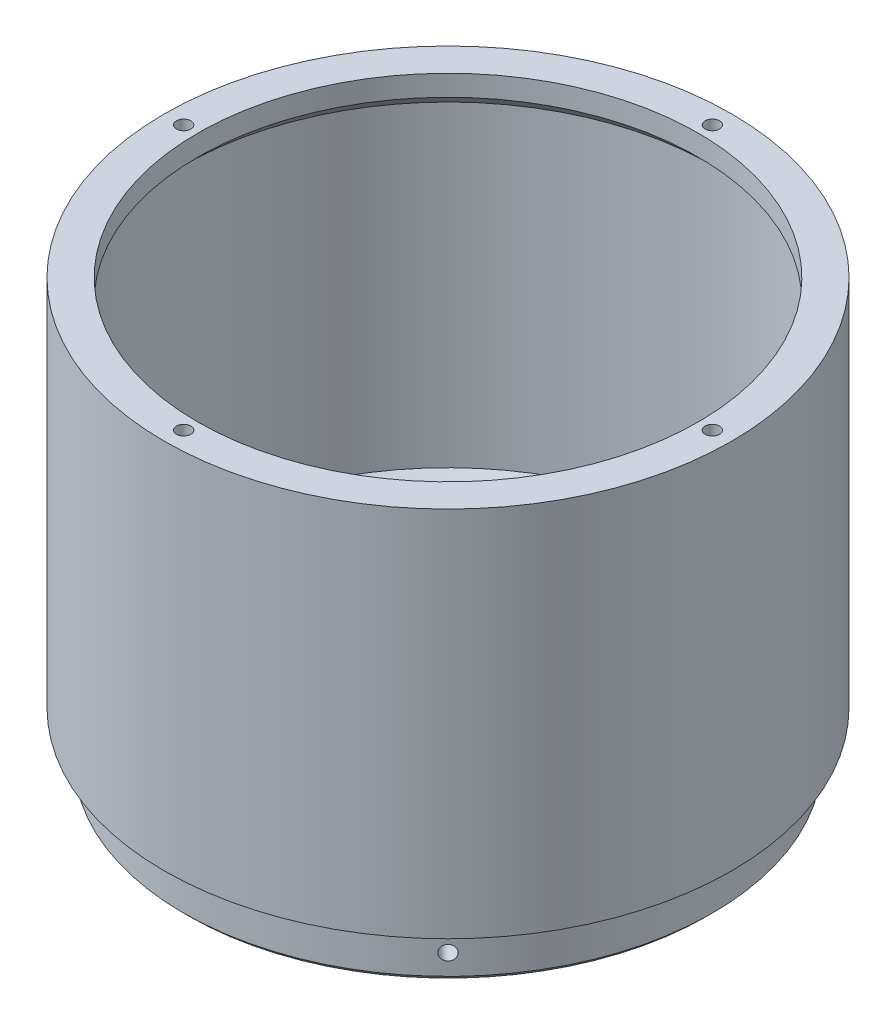
from build123d import *

# Parameters (mm, degrees)
SCHIZZO1_R                         = 110.5
SCHIZZO1_R_2                       = 103
ESTRUSIONE_ESTRUSIONE1_DEPTH       = 136.9
ESTRUSIONE_ESTRUSIONE2_DEPTH       = 10
ESTRUSIONE_ESTRUSIONE2_DEPTH_BACK  = 20
SCHIZZO1_3_R                       = 103
SCHIZZO1_3_R_2                     = 95
SMUSSO1_SIZE                       = 10
SMUSSO2_SIZE                       = 2
SCHIZZO2_R                         = 110.5
SCHIZZO2_R_2                       = 97.5
ESTRUSIONE_ESTRUSIONE3_DEPTH       = 8.1
SMUSSO3_SIZE                       = 5.5
FORO_PER_VITE_M4_1_D               = 5.6
FORO_PER_VITE_M4_1_DEPTH           = 8.1
FORO_PER_VITE_M4_1_TIP             = 1.682409733
FORO_PER_VITE_M4_2_D               = 5.6
FORO_PER_VITE_M4_2_DEPTH           = 8.1
FORO_PER_VITE_M4_2_TIP             = 1.682409733
FORO_PER_VITE_M4_2_ON_FACE_2_D     = 5.6
FORO_PER_VITE_M4_2_ON_FACE_2_DEPTH = 8.1
FORO_PER_VITE_M4_2_ON_FACE_2_TIP   = 1.682409733
FORO_PER_VITE_M4_2_ON_FACE_3_D     = 5.6
FORO_PER_VITE_M4_2_ON_FACE_3_DEPTH = 8.1
FORO_PER_VITE_M4_2_ON_FACE_3_TIP   = 1.682409733
FORO_PER_VITE_M4_2_ON_FACE_4_D     = 5.6
FORO_PER_VITE_M4_2_ON_FACE_4_DEPTH = 8.1
FORO_PER_VITE_M4_2_ON_FACE_4_TIP   = 1.682409733
ESTRUSIONE_ESTRUSIONE4_DEPTH       = 46
SMUSSO4_SIZE                       = 2


# Read off the part's stored shape, not the designer's step: Foro per Vite M4-3
# Some blends are built 0.0001 mm under size
with BuildPart() as part:
    # Schizzo1 → Estrusione-Estrusione1 (new body)
    with BuildSketch(Plane(origin=(0, 0, 0), x_dir=(1, 0, 0), z_dir=(0, 1, 0))):
        with Locations(Location((0, 0, 0), (0, 0, 270))):
            Circle(SCHIZZO1_R)
        with Locations(Location((0, 0, 0), (0, 0, 270))):
            Circle(SCHIZZO1_R_2, mode=Mode.SUBTRACT)
    extrude(amount=ESTRUSIONE_ESTRUSIONE1_DEPTH)

    # Schizzo1<3> → Estrusione-Estrusione2 (add, two sides: drawn at the far end of the back side and taken through both)
    with BuildSketch(Plane(origin=(0, 0, 0), x_dir=(1, 0, 0), z_dir=(0, 1, 0)).offset(-ESTRUSIONE_ESTRUSIONE2_DEPTH_BACK)):
        with Locations(Location((0, 0, 0), (0, 0, 270))):
            Circle(SCHIZZO1_3_R)
        with Locations(Location((0, 0, 0), (0, 0, 270))):
            Circle(SCHIZZO1_3_R_2, mode=Mode.SUBTRACT)
    extrude(amount=ESTRUSIONE_ESTRUSIONE2_DEPTH + ESTRUSIONE_ESTRUSIONE2_DEPTH_BACK)

    # Smusso1
    # the kernel refuses this chamfer: 10 mm, written as the material it takes off along each edge
    with BuildSketch(Plane(origin=(0, 10, 0), x_dir=(0, 0, 1), z_dir=(-1, 0, 0))) as smusso1_piece_1_section:
        Polygon((95 + SMUSSO1_SIZE, 0), (95, -SMUSSO1_SIZE), (95, 0), align=None)
    smusso1_piece_1 = revolve(axis=Axis((0, 10, 0), (0, 1, 0)), mode=Mode.PRIVATE)
    smusso1_piece_1 = smusso1_piece_1 & Plane(origin=(0, 4.08333284, 0), x_dir=(0, 0, 1), z_dir=(0, -1, 0)) * Cylinder(103, 420, mode=Mode.PRIVATE)
    add(smusso1_piece_1, mode=Mode.SUBTRACT)

    # Smusso2
    smusso2_edges = [part.edges().sort_by_distance(p)[0] for p in [
        (0, -20, -95),
        (0, -20, -103),
    ]]
    chamfer(smusso2_edges, length=SMUSSO2_SIZE)

    # Schizzo2 → Estrusione-Estrusione3 (add)
    with BuildSketch(Plane(origin=(0, 136.9, 0), x_dir=(1, 0, 0), z_dir=(0, 1, 0))):
        with Locations(Location((0, 0, 0), (0, 0, 270))):
            Circle(SCHIZZO2_R)
        with Locations(Location((0, 0, 0), (0, 0, 270))):
            Circle(SCHIZZO2_R_2, mode=Mode.SUBTRACT)
    extrude(amount=ESTRUSIONE_ESTRUSIONE3_DEPTH)

    # Smusso3
    smusso3_edges = [part.edges().sort_by_distance(p)[0] for p in [
        (0, 136.9, -103),
    ]]
    chamfer(smusso3_edges, length=SMUSSO3_SIZE - 0.0001)  # a hair under: the kernel refuses the full size

    # Foro per Vite M4-1
    with Locations(Plane(origin=(0, 145, 0), x_dir=(1, 0, 0), z_dir=(0, 1, 0))):
        with Locations((0, 103), (0, -103), (103, 0), (-103, 0)):
            Hole(FORO_PER_VITE_M4_1_D / 2, depth=FORO_PER_VITE_M4_1_DEPTH)
            with Locations((0, 0, -(FORO_PER_VITE_M4_1_DEPTH + FORO_PER_VITE_M4_1_TIP / 2))):  # 118° drill point
                Cone(0, FORO_PER_VITE_M4_1_D / 2, FORO_PER_VITE_M4_1_TIP, mode=Mode.SUBTRACT)

    # Foro per Vite M4-2
    with Locations(Plane(origin=(72.831998462, -10, -72.831998462), x_dir=(0.707106781187, 0, 0.707106781187), z_dir=(0.707106781187, 0, -0.707106781187))):
        with Locations((0, 0)):
            Hole(FORO_PER_VITE_M4_2_D / 2, depth=FORO_PER_VITE_M4_2_DEPTH)
            with Locations((0, 0, -(FORO_PER_VITE_M4_2_DEPTH + FORO_PER_VITE_M4_2_TIP / 2))):  # 118° drill point
                Cone(0, FORO_PER_VITE_M4_2_D / 2, FORO_PER_VITE_M4_2_TIP, mode=Mode.SUBTRACT)

    # Foro per Vite M4-2 on face 2
    with Locations(Plane(origin=(-72.831998462, -10, -72.831998462), x_dir=(-0.707106781187, 0, 0.707106781187), z_dir=(-0.707106781187, 0, -0.707106781187))):
        with Locations((0, 0)):
            Hole(FORO_PER_VITE_M4_2_ON_FACE_2_D / 2, depth=FORO_PER_VITE_M4_2_ON_FACE_2_DEPTH)
            with Locations((0, 0, -(FORO_PER_VITE_M4_2_ON_FACE_2_DEPTH + FORO_PER_VITE_M4_2_ON_FACE_2_TIP / 2))):  # 118° drill point
                Cone(0, FORO_PER_VITE_M4_2_ON_FACE_2_D / 2, FORO_PER_VITE_M4_2_ON_FACE_2_TIP, mode=Mode.SUBTRACT)

    # Foro per Vite M4-2 on face 3
    with Locations(Plane(origin=(-72.831998462, -10, 72.831998462), x_dir=(0.707106781187, 0, 0.707106781187), z_dir=(-0.707106781187, 0, 0.707106781187))):
        with Locations((0, 0)):
            Hole(FORO_PER_VITE_M4_2_ON_FACE_3_D / 2, depth=FORO_PER_VITE_M4_2_ON_FACE_3_DEPTH)
            with Locations((0, 0, -(FORO_PER_VITE_M4_2_ON_FACE_3_DEPTH + FORO_PER_VITE_M4_2_ON_FACE_3_TIP / 2))):  # 118° drill point
                Cone(0, FORO_PER_VITE_M4_2_ON_FACE_3_D / 2, FORO_PER_VITE_M4_2_ON_FACE_3_TIP, mode=Mode.SUBTRACT)

    # Foro per Vite M4-2 on face 4
    with Locations(Plane(origin=(72.831998462, -10, 72.831998462), x_dir=(0.707106781187, 0, -0.707106781187), z_dir=(0.707106781187, 0, 0.707106781187))):
        with Locations((0, 0)):
            Hole(FORO_PER_VITE_M4_2_ON_FACE_4_D / 2, depth=FORO_PER_VITE_M4_2_ON_FACE_4_DEPTH)
            with Locations((0, 0, -(FORO_PER_VITE_M4_2_ON_FACE_4_DEPTH + FORO_PER_VITE_M4_2_ON_FACE_4_TIP / 2))):  # 118° drill point
                Cone(0, FORO_PER_VITE_M4_2_ON_FACE_4_D / 2, FORO_PER_VITE_M4_2_ON_FACE_4_TIP, mode=Mode.SUBTRACT)

    # Schizzo7 → Estrusione-Estrusione4 (add)
    with BuildSketch(Plane.XZ.offset(-30)):
        with BuildLine():
            Line((-35, -104.810543363), (-35, -110.5))
            Line((-35, -110.5), (-35, -112.5))
            Line((-35, -112.5), (35, -112.5))
            Line((35, -112.5), (35, -110.5))
            Line((35, -110.5), (35, -104.810543363))
            ThreePointArc((35, -104.810543363), (0, -110.5), (-35, -104.810543363))
        make_face()
    extrude(amount=-ESTRUSIONE_ESTRUSIONE4_DEPTH)

    # Smusso4
    smusso4_edges = [part.edges().sort_by_distance(p)[0] for p in [
        (0, 76, -110.5),
        (0, 30, -110.5),
    ]]
    chamfer(smusso4_edges, length=SMUSSO4_SIZE - 0.0001)  # a hair under: the kernel refuses the full size

    # Foro per Vite M4-3 outline → Foro per Vite M4-3 (revolve, cut)
    with BuildSketch(Plane(origin=(-29, 36, 0), x_dir=(1, 0, 0), z_dir=(0, -1, 0))):
        Polygon((2.7, -104.4), (0, -102.777676329), (0, -112.5), (2.7, -112.5), align=None)
    revolve(axis=Axis((-29, 36, 0), (0, 0, 1)), mode=Mode.SUBTRACT)

    # Foro per Vite M4-3 2 outline → Foro per Vite M4-3 2 (revolve, cut)
    with BuildSketch(Plane(origin=(29, 70, 0), x_dir=(1, 0, 0), z_dir=(0, -1, 0))):
        Polygon((2.7, -104.4), (0, -102.777676329), (0, -112.5), (2.7, -112.5), align=None)
    revolve(axis=Axis((29, 70, 0), (0, 0, 1)), mode=Mode.SUBTRACT)

    # Foro per Vite M4-3 3 outline → Foro per Vite M4-3 3 (revolve, cut)
    with BuildSketch(Plane(origin=(-29, 70, 0), x_dir=(1, 0, 0), z_dir=(0, -1, 0))):
        Polygon((2.7, -104.4), (0, -102.777676329), (0, -112.5), (2.7, -112.5), align=None)
    revolve(axis=Axis((-29, 70, 0), (0, 0, 1)), mode=Mode.SUBTRACT)

    # Foro per Vite M4-3 4 outline → Foro per Vite M4-3 4 (revolve, cut)
    with BuildSketch(Plane(origin=(29, 36, 0), x_dir=(1, 0, 0), z_dir=(0, -1, 0))):
        Polygon((2.7, -104.4), (0, -102.777676329), (0, -112.5), (2.7, -112.5), align=None)
    revolve(axis=Axis((29, 36, 0), (0, 0, 1)), mode=Mode.SUBTRACT)


solid = part.part
